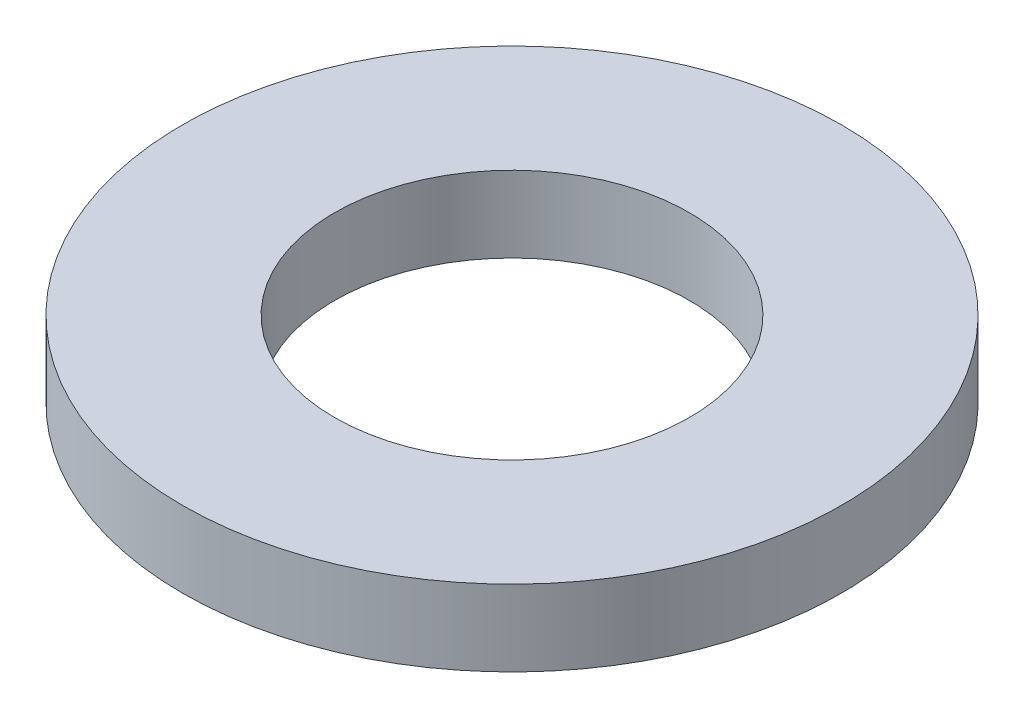
from build123d import *

# Parameters (mm, degrees)
SKETCH1_R           = 65
BOSS_EXTRUDE1_DEPTH = 15
SKETCH2_R           = 35
CUT_EXTRUDE1_DEPTH  = 94.139680051


with BuildPart() as part:
    # Sketch1 → Boss-Extrude1 (new body)
    with BuildSketch(Plane(origin=(0, 0, 0), x_dir=(1, 0, 0), z_dir=(0, 1, 0))):
        Circle(SKETCH1_R)
    extrude(amount=BOSS_EXTRUDE1_DEPTH)

    # Sketch2 → Cut-Extrude1 (cut, through all)
    with BuildSketch(Plane(origin=(0, 0, 0), x_dir=(1, 0, 0), z_dir=(0, 1, 0))):
        Circle(SKETCH2_R)
    extrude(amount=CUT_EXTRUDE1_DEPTH, mode=Mode.SUBTRACT)


solid = part.part
